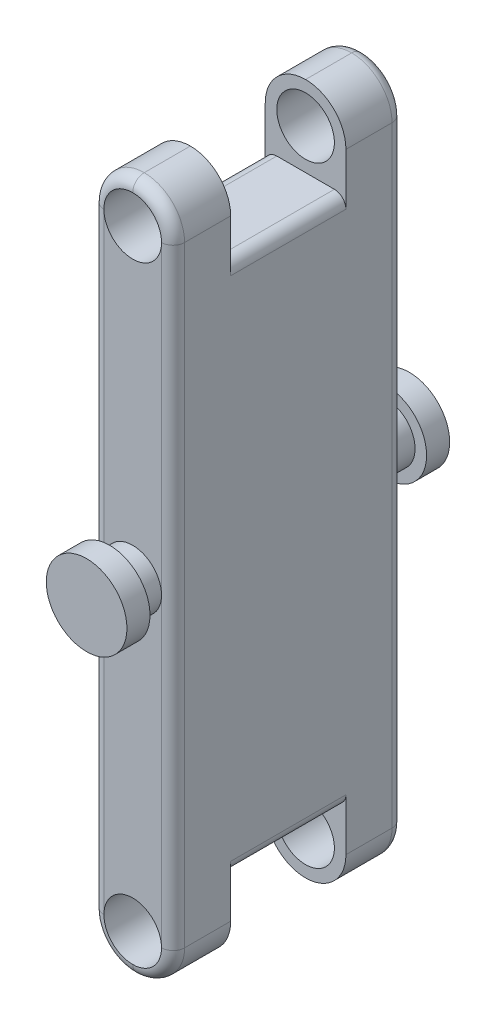
from build123d import *

# Parameters (mm, degrees)
SKETCH1_W               = 14
SKETCH1_H               = 20
BOSS_EXTRUDE1_DEPTH     = 120
SKETCH4_W               = 14
SKETCH4_H               = 10
CUT_EXTRUDE3_DEPTH      = 14
SKETCH6_R               = 5
CUT_EXTRUDE5_DEPTH      = 10
SKETCH10_W              = 14
SKETCH10_H              = 20
CUT_EXTRUDE8_DEPTH      = 14
SKETCH12_R              = 5
BOSS_EXTRUDE2_DEPTH     = 4
SKETCH13_R              = 7
BOSS_EXTRUDE3_DEPTH     = 4
CUT_EXTRUDE9_DEPTH      = 125.016127983
CUT_EXTRUDE9_DEPTH_BACK = 125.016127983
SKETCH14_R              = 5
FILLET1_R               = 7
FILLET2_R               = 2


with BuildPart() as part:
    # Sketch1 → Boss-Extrude1 (new body)
    with BuildSketch(Plane(origin=(0, 0, 0), x_dir=(1, 0, 0), z_dir=(0, 1, 0))):
        with Locations((7, -10)):
            Rectangle(SKETCH1_W, SKETCH1_H)
    boss_extrude1 = extrude(amount=BOSS_EXTRUDE1_DEPTH)

    # Sketch4 → Cut-Extrude3 (cut)
    with BuildSketch(Plane(origin=(0, 120, 0), x_dir=(1, 0, 0), z_dir=(0, 1, 0))):
        with Locations((7, -5)):
            Rectangle(SKETCH4_W, SKETCH4_H)
    cut_extrude3 = extrude(amount=-CUT_EXTRUDE3_DEPTH, mode=Mode.SUBTRACT)

    # Sketch6 → Cut-Extrude5 (cut)
    with BuildSketch(Plane(origin=(0, 0, 10), x_dir=(-1, 0, 0), z_dir=(0, 0, -1))):
        with Locations((-7, 113)):
            Circle(SKETCH6_R)
    cut_extrude5 = extrude(amount=-CUT_EXTRUDE5_DEPTH, mode=Mode.SUBTRACT)

    # Mirror1: Boss-Extrude1, Cut-Extrude3, Cut-Extrude5 across plane
    add(boss_extrude1.mirror(Plane(origin=(0, 120, 0), x_dir=(1, 0, 0), z_dir=(0, 0, 1))))
    add(cut_extrude3.mirror(Plane(origin=(0, 120, 0), x_dir=(1, 0, 0), z_dir=(0, 0, 1))), mode=Mode.SUBTRACT)
    add(cut_extrude5.mirror(Plane(origin=(0, 120, 0), x_dir=(1, 0, 0), z_dir=(0, 0, 1))), mode=Mode.SUBTRACT)

    # Sketch10 → Cut-Extrude8 (cut)
    with BuildSketch(Plane.XZ):
        with Locations((7, 0)):
            Rectangle(SKETCH10_W, SKETCH10_H)
    extrude(amount=-CUT_EXTRUDE8_DEPTH, mode=Mode.SUBTRACT)

    # Sketch12 → Boss-Extrude2 (add)
    with BuildSketch(Plane.XY.offset(20)):
        with Locations(Location((7, 60, 0), (0, 0, 180))):
            Circle(SKETCH12_R)
    boss_extrude2 = extrude(amount=BOSS_EXTRUDE2_DEPTH)

    # Sketch13 → Boss-Extrude3 (add)
    with BuildSketch(Plane.XY.offset(24)):
        with Locations((7, 60)):
            Circle(SKETCH13_R)
    boss_extrude3 = extrude(amount=BOSS_EXTRUDE3_DEPTH)

    # Mirror3: Boss-Extrude2, Boss-Extrude3 across plane
    add(boss_extrude2.mirror(Plane.XY))
    add(boss_extrude3.mirror(Plane.XY))

    # Sketch14 → Cut-Extrude9 (cut, two sides: drawn at the far end of the back side and taken through both)
    with BuildSketch(Plane.XY.offset(-CUT_EXTRUDE9_DEPTH_BACK)):
        with Locations(Location((7, 7, 0), (0, 0, 180))):
            Circle(SKETCH14_R)
    extrude(amount=CUT_EXTRUDE9_DEPTH + CUT_EXTRUDE9_DEPTH_BACK, mode=Mode.SUBTRACT)

    # Fillet1
    fillet1_edges = [part.edges().sort_by_distance(p)[0] for p in [
        (14, 0, 15),
        (0, 0, 15),
        (14, 0, -15),
        (0, 0, -15),
        (14, 120, 15),
        (0, 120, 15),
        (0, 120, -15),
        (14, 120, -15),
    ]]
    fillet(fillet1_edges, radius=FILLET1_R - 0.0001)  # a hair under: the kernel refuses the full size

    # Fillet2
    fillet2_edges = [part.edges().sort_by_distance(p)[0] for p in [
        (14, 60, -20),
        (14, 60, 20),
        (0, 60, 20),
        (0, 60, -20),
        (0, 106, 0),
        (14, 106, 0),
        (0, 14, 0),
        (14, 14, 0),
        (2.050223242, 117.949776758, 20),
        (2.050223242, 2.050223242, 20),
        (11.949776758, 2.050223242, 20),
        (11.949776758, 117.949776758, -20),
        (2.050223242, 2.050223242, -20),
        (11.949776758, 2.050223242, -20),
    ]]
    fillet(fillet2_edges, radius=FILLET2_R - 0.0001)  # a hair under: the kernel refuses the full size


solid = part.part
